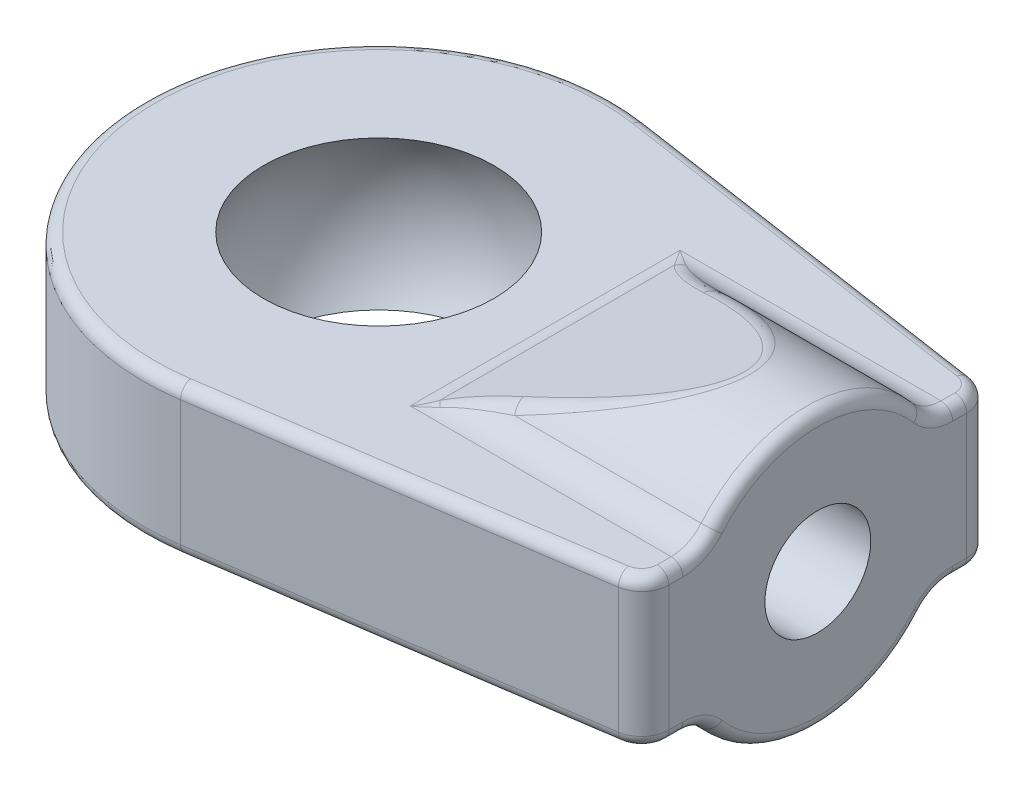
from build123d import *

# Parameters (mm, degrees)
BOSS_EXTRUDE1_DEPTH            = 1.9
BOSS_EXTRUDE1_DEPTH_BACK       = 1.9
SKETCH2_W                      = 6.8
SKETCH2_H                      = 3.5
CUT_EXTRUDE1_REACH             = 15.179
CUT_EXTRUDE1_DIRECTION_2_REACH = 15.179
FILLET1_R                      = 1
FILLET2_R                      = 0.5
SKETCH6_R                      = 1.35
CUT_EXTRUDE2_DEPTH             = 7
FILLET3_R                      = 0.7
FILLET4_R                      = 0.3


with BuildPart() as part:
    # Sketch1 → Boss-Extrude1 (new, two sides: drawn at the far end of the back side and taken through both)
    with BuildSketch(Plane(origin=(0, 0, 0), x_dir=(1, 0, 0), z_dir=(0, 1, 0)).offset(-BOSS_EXTRUDE1_DEPTH_BACK)):
        with BuildLine():
            Line((11.2, -4.4), (11.2, 4.4))
            Line((11.2, 4.4), (0.882796204, 5.93470057))
            ThreePointArc((0.882796204, 5.93470057), (-6, 0), (0.882796204, -5.93470057))
            Line((0.882796204, -5.93470057), (11.2, -4.4))
        make_face()
    extrude(amount=BOSS_EXTRUDE1_DEPTH + BOSS_EXTRUDE1_DEPTH_BACK)

    # Sketch2 → Revolve2 (revolve)
    with BuildSketch(Plane(origin=(0, 0, 0), x_dir=(1, 0, 0), z_dir=(0, 1, 0))):
        with Locations((7.8, 1.75)):
            Rectangle(SKETCH2_W, SKETCH2_H)
    revolve(axis=Axis((0, 0, 0), (1, 0, 0)))

    # Sketch4 → Cut-Revolve1 (revolve, cut)
    with BuildSketch(Plane(origin=(0, 0, 0), x_dir=(1, 0, 0), z_dir=(0, 1, 0))):
        with BuildLine():
            Line((3.5, 0), (-3.5, 0))
            ThreePointArc((-3.5, 0), (0, 3.5), (3.5, 0))
        make_face()
    revolve(axis=Axis((0, 0, 0), (1, 0, 0)), mode=Mode.SUBTRACT)

    # Sketch5 → Cut-Extrude1 (cut, up to next)
    with BuildSketch(Plane.XY, mode=Mode.PRIVATE) as cut_extrude1_sk1:
        Polygon((4.4, 1.9), (9.4, 3.5), (4.4, 3.5), align=None)
    cut_extrude1_tool1 = extrude(cut_extrude1_sk1.sketch, amount=-CUT_EXTRUDE1_REACH, mode=Mode.PRIVATE) & part.part
    # Sketch5 → Cut-Extrude1 (cut, up to next)
    with BuildSketch(Plane.XY, mode=Mode.PRIVATE) as cut_extrude1_sk2:
        Polygon((4.4, -3.5), (4.4, -1.9), (9.4, -3.5), align=None)
    cut_extrude1_tool2 = extrude(cut_extrude1_sk2.sketch, amount=-CUT_EXTRUDE1_REACH, mode=Mode.PRIVATE) & part.part
    add(cut_extrude1_tool1.solids().sort_by_distance((6.066667, 2.966667, 0))[0], mode=Mode.SUBTRACT)
    add(cut_extrude1_tool2.solids().sort_by_distance((6.066667, -2.966667, 0))[0], mode=Mode.SUBTRACT)

    # Sketch5 → Cut-Extrude1 direction 2 (cut, up to next)
    with BuildSketch(Plane.XY, mode=Mode.PRIVATE) as cut_extrude1_direction_2_sk1:
        Polygon((4.4, 1.9), (9.4, 3.5), (4.4, 3.5), align=None)
    cut_extrude1_direction_2_tool1 = extrude(cut_extrude1_direction_2_sk1.sketch, amount=CUT_EXTRUDE1_DIRECTION_2_REACH, mode=Mode.PRIVATE) & part.part
    # Sketch5 → Cut-Extrude1 direction 2 (cut, up to next)
    with BuildSketch(Plane.XY, mode=Mode.PRIVATE) as cut_extrude1_direction_2_sk2:
        Polygon((4.4, -3.5), (4.4, -1.9), (9.4, -3.5), align=None)
    cut_extrude1_direction_2_tool2 = extrude(cut_extrude1_direction_2_sk2.sketch, amount=CUT_EXTRUDE1_DIRECTION_2_REACH, mode=Mode.PRIVATE) & part.part
    add(cut_extrude1_direction_2_tool1.solids().sort_by_distance((6.066667, 2.966667, 0))[0], mode=Mode.SUBTRACT)
    add(cut_extrude1_direction_2_tool2.solids().sort_by_distance((6.066667, -2.966667, 0))[0], mode=Mode.SUBTRACT)

    # Fillet1
    fillet1_edges = [part.edges().sort_by_distance(p)[0] for p in [
        (4.4, 1.9, 0),
        (4.4, -1.9, 0),
        (7.8, -1.9, 2.939387691),
        (7.8, -1.9, -2.939387691),
        (7.8, 1.9, -2.939387691),
        (7.8, 1.9, 2.939387691),
    ]]
    fillet(fillet1_edges, radius=FILLET1_R)

    # Fillet2
    fillet2_edges = [part.edges().sort_by_distance(p)[0] for p in [
        (4.397223304, -1.911824104, 3.287605616),
        (5.004180275, -2.093337688, 2.849917489),
        (4.397223304, -1.911824104, -3.287605616),
        (5.004180275, -2.093337688, -2.849917489),
        (4.397223304, 1.911824104, -3.287605616),
        (5.004180275, 2.093337688, -2.849917489),
        (4.397223304, 1.911824104, 3.287605616),
        (5.004180275, 2.093337688, 2.849917489),
        (7.819096726, -2.994110952, 1.812539546),
        (7.819096726, 2.994110952, 1.812539546),
    ]]
    fillet(fillet2_edges, radius=FILLET2_R)

    # Sketch6 → Cut-Extrude2 (cut)
    with BuildSketch(Plane(origin=(11.2, 0, 0), x_dir=(0, 0, -1), z_dir=(1, 0, 0))):
        Circle(SKETCH6_R)
    extrude(amount=-CUT_EXTRUDE2_DEPTH, mode=Mode.SUBTRACT)

    # Fillet3
    fillet3_edges = [part.edges().sort_by_distance(p)[0] for p in [
        (11.2, 0, 4.4),
        (11.2, 0, -4.4),
    ]]
    fillet(fillet3_edges, radius=FILLET3_R)

    # Fillet4
    fillet4_edges = [part.edges().sort_by_distance(p)[0] for p in [
        (11.030139144, -1.9, -4.253537241),
        (11.2, -1.9, -3.618677068),
        (11.2, -1.993235299, -3.019293085),
        (11.2, -3.5, 0),
        (11.2, -1.993235299, 3.019293085),
        (11.2, -1.9, 3.618677068),
        (11.030139144, -1.9, 4.253537241),
        (5.742894547, -1.9, 5.211753167),
        (-6, -1.9, 0),
        (11.030139144, 1.9, -4.253537241),
        (11.2, 1.9, -3.618677068),
        (11.2, 1.993235299, -3.019293085),
        (11.2, 3.5, 0),
        (11.2, 1.993235299, 3.019293085),
        (11.2, 1.9, 3.618677068),
        (11.030139144, 1.9, 4.253537241),
        (5.742894547, 1.9, 5.211753167),
        (-6, 1.9, 0),
        (5.742894547, -1.9, -5.211753167),
        (5.742894547, 1.9, -5.211753167),
    ]]
    fillet(fillet4_edges, radius=FILLET4_R)


solid = part.part
